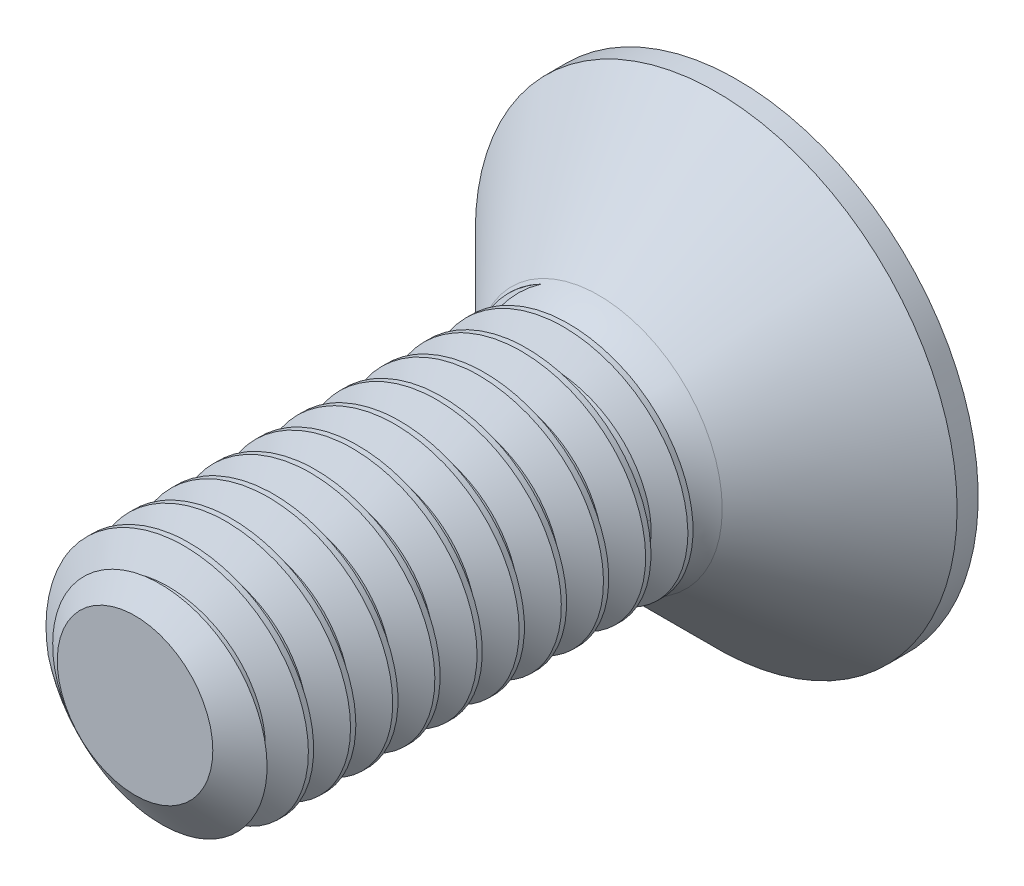
from build123d import *

# Parameters (mm, degrees)
SKETCH1_R          = 2
EXTRUDE1_DEPTH     = 10
CUT_SWEEP1_PITCH   = 0.7
SKETCH6_R          = 4
EXTRUDE2_DEPTH     = 2.3
CUT_EXTRUDE1_DEPTH = 1.875
SKETCH8_R          = 1.443375673
CUT_EXTRUDE2_DEPTH = 12.48912538
CUT_EXTRUDE2_TAPER = 45


with BuildPart() as part:
    # Sketch1 → Extrude1 (new body)
    with BuildSketch(Plane.XY):
        Circle(SKETCH1_R)
    extrude(amount=-EXTRUDE1_DEPTH)

    # Cut-Sweep1: the profile of Sketch3 profile screwed along a right-hand helix of 15.285714 turns, 6 arcs to a turn; built about Z, then put on its axis
    cut_sweep1_z = Axis((0, 0, 0), (0, 0, 1))
    cut_sweep1_corners = [(2.0003, 0, -0.612673205), (1.545336663, 0, -0.35), (1.545336663, 0, -0.2625), (2.0003, 0, 0.000173205)]
    with BuildLine(mode=Mode.PRIVATE) as cut_sweep1_profile:
        Line(cut_sweep1_corners[0], cut_sweep1_corners[1])
        Line(cut_sweep1_corners[1], cut_sweep1_corners[2])
        Line(cut_sweep1_corners[2], cut_sweep1_corners[3])
        Line(cut_sweep1_corners[3], cut_sweep1_corners[0])
    cut_sweep1_cap = Face(cut_sweep1_profile.wire())
    cut_sweep1_turn_angles = [0, 30, 60, 90, 120, 150, 180, 210, 240, 270, 300, 330, 360]
    cut_sweep1_turn_weights = [1, 0.8660254037844387, 1, 0.8660254037844387, 1, 0.8660254037844387, 1, 0.8660254037844387, 1, 0.8660254037844387, 1, 0.8660254037844387, 1]
    cut_sweep1_turn_rails = [Edge.make_bspline([Vector(p[0], p[1], 0).rotate(cut_sweep1_z, cut_sweep1_turn_angles[k]) / cut_sweep1_turn_weights[k] + Vector(0, 0, p[2] + CUT_SWEEP1_PITCH * cut_sweep1_turn_angles[k] / 360) for k in range(13)], [0, 0, 0, 1, 1, 2, 2, 3, 3, 4, 4, 5, 5, 6, 6, 6], 2, cut_sweep1_turn_weights) for p in cut_sweep1_corners]
    cut_sweep1_turn_sides = [Face.make_surface_from_curves(cut_sweep1_turn_rails[p[0]], cut_sweep1_turn_rails[p[1]]) for p in [(0, 1), (1, 2), (2, 3), (3, 0)]]
    cut_sweep1_last_angles = [5400, 5430, 5460, 5481.428571429, 5502.857142857]
    cut_sweep1_last_weights = [1, 0.8660254037844387, 1, 0.9308737486442353, 1]
    cut_sweep1_last_rails = [Edge.make_bspline([Vector(p[0], p[1], 0).rotate(cut_sweep1_z, cut_sweep1_last_angles[k]) / cut_sweep1_last_weights[k] + Vector(0, 0, p[2] + CUT_SWEEP1_PITCH * cut_sweep1_last_angles[k] / 360) for k in range(5)], [0, 0, 0, 1, 1, 2, 2, 2], 2, cut_sweep1_last_weights) for p in cut_sweep1_corners]
    cut_sweep1_last_sides = [Face.make_surface_from_curves(cut_sweep1_last_rails[p[0]], cut_sweep1_last_rails[p[1]]) for p in [(0, 1), (1, 2), (2, 3), (3, 0)]]
    cut_sweep1 = Plane(origin=(0, 0, 0), x_dir=(0, 1, 0), z_dir=(0, 0, -1)) * Solid(Shell([*[p.moved(Location((0, 0, CUT_SWEEP1_PITCH * i))) for i in range(15) for p in cut_sweep1_turn_sides], *cut_sweep1_last_sides, cut_sweep1_cap, cut_sweep1_cap.rotate(cut_sweep1_z, 5502.857142857).moved(Location((0, 0, CUT_SWEEP1_PITCH * 5502.857142857 / 360)))]))
    add(cut_sweep1, mode=Mode.SUBTRACT)

    # Sketch4 → Cut-Revolve1 (revolve, cut)
    with BuildSketch(Plane(origin=(0, 0, 0), x_dir=(0, 0, -1), z_dir=(1, 0, 0)), mode=Mode.PRIVATE) as cut_revolve1_sk:
        Polygon((0.496211411, 2), (0, 1.291336663), (0, 2), align=None)
    revolve(cut_revolve1_sk.sketch.rotate(Axis((0, 0, 0), (0, 0, -1)), 271.401126896), axis=Axis((0, 0, 0), (0, 0, -1)), mode=Mode.SUBTRACT)

    # Sketch6 → Extrude2 (add)
    with BuildSketch(Plane(origin=(0, 0, -10), x_dir=(-1, 0, 0), z_dir=(0, 0, -1))):
        Circle(SKETCH6_R)
    extrude(amount=-EXTRUDE2_DEPTH)

    # Sketch10 → Cut-Revolve2 (revolve, cut)
    with BuildSketch(Plane(origin=(0, 0, 0), x_dir=(0, 0, -1), z_dir=(1, 0, 0)), mode=Mode.PRIVATE) as cut_revolve2_sk:
        Polygon((9.65, -4), (7.7, -2.05), (7.7, -4), align=None)
    revolve(cut_revolve2_sk.sketch.rotate(Axis((0, 0, 0), (0, 0, -1)), 270), axis=Axis((0, 0, 0), (0, 0, -1)), mode=Mode.SUBTRACT)

    # Sketch11 → Revolve1 (revolve)
    with BuildSketch(Plane(origin=(0, 0, 0), x_dir=(0, 0, -1), z_dir=(1, 0, 0)), mode=Mode.PRIVATE) as revolve1_sk:
        with BuildLine():
            Line((6.481634927, 1.545336663), (6.481634927, 0))
            Line((6.481634927, 0), (7.7, 0))
            Line((7.7, 0), (7.7, 2.05))
            ThreePointArc((7.7, 2.05), (7.141009353, 1.676494391), (6.481634927, 1.545336663))
        make_face()
    revolve(revolve1_sk.sketch.rotate(Axis((0, 0, 0), (0, 0, -1)), 90), axis=Axis((0, 0, 0), (0, 0, -1)))

    # Sketch7 → Cut-Extrude1 (cut)
    with BuildSketch(Plane.XY.offset(-10)):
        Polygon((0, 1.443375673), (-1.25, 0.721687836), (-1.25, -0.721687836), (0, -1.443375673), (1.25, -0.721687836), (1.25, 0.721687836), align=None)
    extrude(amount=CUT_EXTRUDE1_DEPTH, mode=Mode.SUBTRACT)

    # Sketch8 → Cut-Extrude2 (cut, through all)
    with BuildSketch(Plane.XY.offset(-10)):
        Circle(SKETCH8_R)
    extrude(amount=CUT_EXTRUDE2_DEPTH, taper=CUT_EXTRUDE2_TAPER, mode=Mode.SUBTRACT)


solid = part.part
